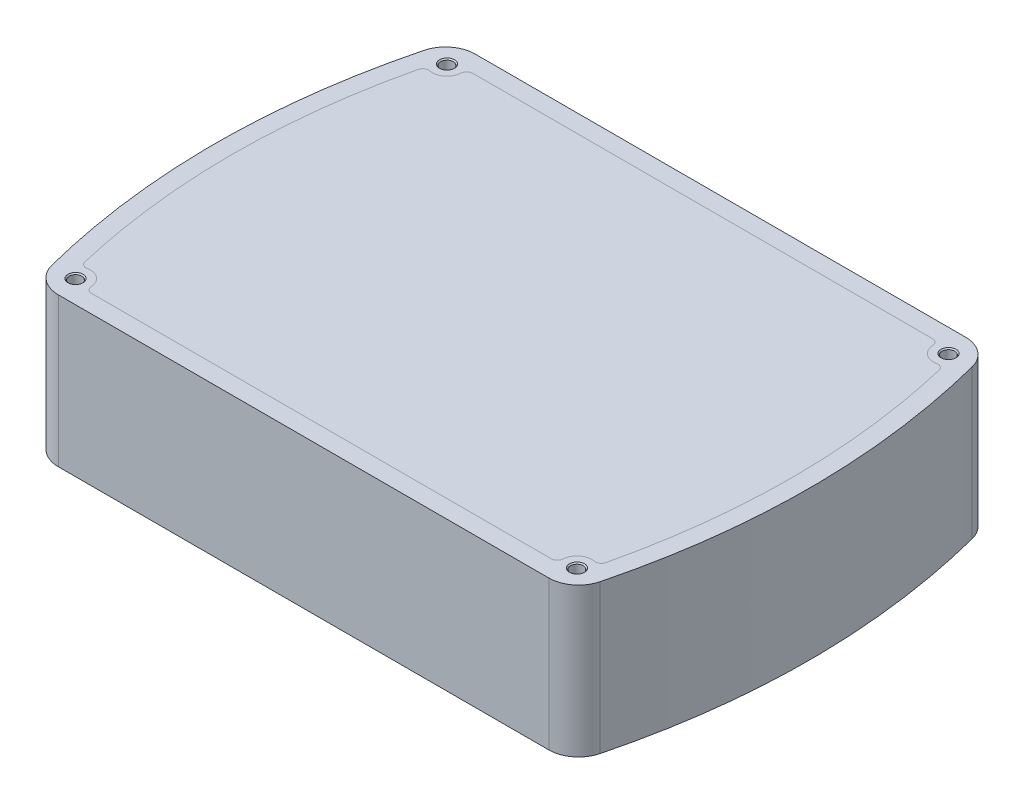
from build123d import *

# Parameters (mm, degrees)
BOSS_EXTRUDE1_DEPTH                    = 50
FILLET5_R                              = 10
SHELL1_T                               = -6
SKETCH18_R                             = 5
BOSS_EXTRUDE2_DEPTH                    = 44
CBORE_FOR_M5_HEX_HEAD_BOLT1_AT_2_COUNT = 2
CBORE_FOR_M5_HEX_HEAD_BOLT1_AT_2_PITCH = 168.372502246
CBORE_FOR_M5_HEX_HEAD_BOLT1_AT_3_COUNT = 2
CBORE_FOR_M5_HEX_HEAD_BOLT1_AT_3_PITCH = 209.544351234
CBORE_FOR_M5_HEX_HEAD_BOLT1_AT_4_COUNT = 2
CBORE_FOR_M5_HEX_HEAD_BOLT1_AT_4_PITCH = 124.737867634
FILLET6_R                              = 2
SKETCH21_R                             = 3
BOSS_EXTRUDE3_DEPTH                    = 10
LPATTERN1_COUNT                        = 2
LPATTERN1_PITCH                        = 30.48
LPATTERN1_COUNT_DIR2                   = 2
LPATTERN1_PITCH_DIR2                   = 55.88
SKETCH21_3_R                           = 3
BOSS_EXTRUDE4_DEPTH                    = 10
LPATTERN3_COUNT                        = 2
LPATTERN3_PITCH                        = 16.51
LPATTERN3_COUNT_DIR2                   = 2
LPATTERN3_PITCH_DIR2                   = 17.78
LPATTERN3_2_COUNT                      = 2
LPATTERN3_2_PITCH                      = 16.51
LPATTERN3_2_COUNT_DIR2                 = 2
LPATTERN3_2_PITCH_DIR2                 = 17.78
INTERSECT1_START                       = 6
INTERSECT1_OUTLINE_R                   = 3
INTERSECT1_DEPTH                       = 44
INTERSECT1_START_2                     = 16
INTERSECT1_2_OUTLINE_R                 = 3
INTERSECT1_2_DEPTH                     = 34
INTERSECT1_START_3                     = 8.4999999
INTERSECT1_3_OUTLINE_R                 = 1.25
INTERSECT1_3_DEPTH                     = 7.5000001
SKETCH26_R                             = 5
CUT_EXTRUDE5_DEPTH                     = 130.753612831
CUT_EXTRUDE7_DEPTH                     = 130.753612831
CUT_EXTRUDE8_DEPTH                     = 130.753612831


with BuildPart() as part:
    # Sketch1 → Boss-Extrude1 (new body)
    with BuildSketch(Plane(origin=(0, 0, 0), x_dir=(1, 0, 0), z_dir=(0, 1, 0))):
        with BuildLine():
            Line((-90, 70), (90, 70))
            add(Edge.make_bspline(
                [(90, 70), (110, 0), (90, -70)],
                knots=[0, 0, 0, 1, 1, 1], degree=2))
            Line((90, -70), (-90, -70))
            add(Edge.make_bspline(
                [(-90, 70), (-110, 0), (-90, -70)],
                knots=[0, 0, 0, 1, 1, 1], degree=2))
        make_face()
    extrude(amount=BOSS_EXTRUDE1_DEPTH)

    # Fillet5
    fillet5_edges = [part.edges().sort_by_distance(p)[0] for p in [
        (-90, 25, 70),
        (90, 25, 70),
        (90, 25, -70),
        (-90, 25, -70),
    ]]
    fillet(fillet5_edges, radius=FILLET5_R)

    # Shell1
    shell1_openings = [part.faces().sort_by_distance(p)[0] for p in [
        (1e-09, 50, 1e-09),
    ]]
    offset(amount=SHELL1_T, openings=shell1_openings)

    # Sketch18 → Boss-Extrude2 (add)
    with BuildSketch(Plane(origin=(0, 50, 0), x_dir=(1, 0, 0), z_dir=(0, 1, 0))):
        with Locations((-84.186251123, 62.368933817)):
            Circle(SKETCH18_R)
        with Locations((84.186251123, 62.368933817)):
            Circle(SKETCH18_R)
        with Locations((84.186251123, -62.368933817)):
            Circle(SKETCH18_R)
        with Locations((-84.186251123, -62.368933817)):
            Circle(SKETCH18_R)
    extrude(amount=-BOSS_EXTRUDE2_DEPTH)

    # Sketch20 → CBORE for M5 Hex Head Bolt1 (revolve, cut)
    with BuildSketch(Plane(origin=(-84.186251123, 50, -62.368933817), x_dir=(0, 0, 1), z_dir=(1, 0, 0))):
        Polygon((0, 0), (0, 10.901290929), (1.5, 10), (1.5, 4.375), (2.125, 4.375), (2.125, 0.375), (2.5, 0), align=None)
    cbore_for_m5_hex_head_bolt1 = revolve(axis=Axis((-84.186251123, 56.35, -62.368933817), (0, -1, 0)), mode=Mode.SUBTRACT)

    # CBORE for M5 Hex Head Bolt1 at 2: CBORE for M5 Hex Head Bolt1 ×2
    with Locations(*[(i * CBORE_FOR_M5_HEX_HEAD_BOLT1_AT_2_PITCH, 0, 0) for i in range(1, CBORE_FOR_M5_HEX_HEAD_BOLT1_AT_2_COUNT)]):
        add(cbore_for_m5_hex_head_bolt1, mode=Mode.SUBTRACT)

    # CBORE for M5 Hex Head Bolt1 at 3: CBORE for M5 Hex Head Bolt1 ×2
    with Locations(*[Vector(0.8035172566273735, 0, 0.595281461413019) * (i * CBORE_FOR_M5_HEX_HEAD_BOLT1_AT_3_PITCH) for i in range(1, CBORE_FOR_M5_HEX_HEAD_BOLT1_AT_3_COUNT)]):
        add(cbore_for_m5_hex_head_bolt1, mode=Mode.SUBTRACT)

    # CBORE for M5 Hex Head Bolt1 at 4: CBORE for M5 Hex Head Bolt1 ×2
    with Locations(*[(0, 0, i * CBORE_FOR_M5_HEX_HEAD_BOLT1_AT_4_PITCH) for i in range(1, CBORE_FOR_M5_HEX_HEAD_BOLT1_AT_4_COUNT)]):
        add(cbore_for_m5_hex_head_bolt1, mode=Mode.SUBTRACT)

    # Fillet6
    fillet6_edges = [part.edges().sort_by_distance(p)[0] for p in [
        (-79.459770074, 28, 64),
        (-86.920475715, 28, 58.182764222),
        (79.459770074, 28, 64),
        (86.920475715, 28, 58.182764222),
        (86.920475715, 28, -58.182764222),
        (79.459770074, 28, -64),
        (-86.920475715, 28, -58.182764222),
        (-79.459770074, 28, -64),
    ]]
    fillet(fillet6_edges, radius=FILLET6_R)

    # Sketch21 → Boss-Extrude3 (add)
    with BuildSketch(Plane(origin=(0, 6, 0), x_dir=(1, 0, 0), z_dir=(0, 1, 0))):
        with Locations(Location((-40, -27.94, 0), (0, 0, 270))):
            Circle(SKETCH21_R)
    boss_extrude3 = extrude(amount=BOSS_EXTRUDE3_DEPTH)

    # Sketch23 → M3x0.5 Tapped Hole2 (revolve, cut)
    with BuildSketch(Plane(origin=(-40, 16, 27.94), x_dir=(0, 0, 1), z_dir=(1, 0, 0))):
        Polygon((0, 0), (0, 8.251075774), (1.25, 7.5), (1.25, 0), align=None)
    m3x0_5_tapped_hole2 = revolve(axis=Axis((-40, 22.35, 27.94), (0, -1, 0)), mode=Mode.SUBTRACT)

    # LPattern1: Boss-Extrude3, M3x0.5 Tapped Hole2 2 × 2
    with Locations(*[(-i * LPATTERN1_PITCH, 0, -j * LPATTERN1_PITCH_DIR2) for i in range(LPATTERN1_COUNT) for j in range(LPATTERN1_COUNT_DIR2) if (i, j) != (0, 0)]):
        add(boss_extrude3)
        add(m3x0_5_tapped_hole2, mode=Mode.SUBTRACT)

    # Sketch26 → Cut-Extrude5 (cut, through all)
    with BuildSketch(Plane(origin=(0, 6, 0), x_dir=(1, 0, 0), z_dir=(0, 1, 0))):
        with Locations(Location((0, -50, 0), (0, 0, 270))):
            Circle(SKETCH26_R)
    extrude(amount=-CUT_EXTRUDE5_DEPTH, mode=Mode.SUBTRACT)

    # Sketch26<4> → Cut-Extrude7 (cut, through all)
    with BuildSketch(Plane(origin=(0, 6, 0), x_dir=(1, 0, 0), z_dir=(0, 1, 0))):
        with BuildLine():
            Line((-87, 1.7526), (-81, 1.7526))
            ThreePointArc((-81, 1.7526), (-79.2474, 0), (-81, -1.7526))
            Line((-81, -1.7526), (-87, -1.7526))
            ThreePointArc((-87, -1.7526), (-88.7526, 0), (-87, 1.7526))
        make_face()
    extrude(amount=-CUT_EXTRUDE7_DEPTH, mode=Mode.SUBTRACT)

    # Sketch26<5> → Cut-Extrude8 (cut, through all)
    with BuildSketch(Plane(origin=(0, 6, 0), x_dir=(1, 0, 0), z_dir=(0, 1, 0))):
        with BuildLine():
            Line((85.7526, 3), (85.7526, -3))
            ThreePointArc((85.7526, -3), (84, -4.7526), (82.2474, -3))
            Line((82.2474, -3), (82.2474, 3))
            ThreePointArc((82.2474, 3), (84, 4.7526), (85.7526, 3))
        make_face()
    extrude(amount=-CUT_EXTRUDE8_DEPTH, mode=Mode.SUBTRACT)


with BuildPart() as body_2:
    # Sketch21<3> → Boss-Extrude4 (new body)
    with BuildSketch(Plane(origin=(0, 6, 0), x_dir=(1, 0, 0), z_dir=(0, 1, 0))):
        with Locations(Location((-40, -40, 0), (0, 0, 270))):
            Circle(SKETCH21_3_R)
    boss_extrude4 = extrude(amount=BOSS_EXTRUDE4_DEPTH)

    # Sketch25 → M3x0.5 Tapped Hole3 (revolve, cut)
    with BuildSketch(Plane(origin=(-40, 16, 40), x_dir=(0, 0, 1), z_dir=(1, 0, 0))):
        Polygon((0, 0), (0, 8.251075774), (1.25, 7.5), (1.25, 0), align=None)
    m3x0_5_tapped_hole3 = revolve(axis=Axis((-40, 22.35, 40), (0, -1, 0)), mode=Mode.SUBTRACT)


with BuildPart() as lpattern3_1:
    # LPattern3: pattern copy
    add(boss_extrude4.moved(Location(Vector(0, 0, 1) * (0 * LPATTERN3_PITCH) + Vector(1, 0, 0) * (1 * LPATTERN3_PITCH_DIR2))))


with BuildPart() as lpattern3_2:
    # LPattern3: pattern copy
    add(boss_extrude4.moved(Location(Vector(0, 0, 1) * (1 * LPATTERN3_PITCH) + Vector(1, 0, 0) * (0 * LPATTERN3_PITCH_DIR2))))


with BuildPart() as lpattern3_3:
    # LPattern3: pattern copy
    add(boss_extrude4.moved(Location(Vector(0, 0, 1) * (1 * LPATTERN3_PITCH) + Vector(1, 0, 0) * (1 * LPATTERN3_PITCH_DIR2))))


with BuildPart() as lpattern3_2_tool:
    # LPattern3 2: M3x0.5 Tapped Hole3 2 × 2
    with Locations(*[(j * LPATTERN3_2_PITCH_DIR2, 0, i * LPATTERN3_2_PITCH) for i in range(LPATTERN3_2_COUNT) for j in range(LPATTERN3_2_COUNT_DIR2) if (i, j) != (0, 0)]):
        add(m3x0_5_tapped_hole3)


with BuildPart() as lpattern3_1_1:
    add(lpattern3_1.part)

    # LPattern3 2: cut by lpattern3_2_tool
    add(lpattern3_2_tool.part, mode=Mode.SUBTRACT)


with BuildPart() as lpattern3_2_1:
    add(lpattern3_2.part)

    # LPattern3 2: cut by lpattern3_2_tool
    add(lpattern3_2_tool.part, mode=Mode.SUBTRACT)


with BuildPart() as lpattern3_3_1:
    add(lpattern3_3.part)

    # LPattern3 2: cut by lpattern3_2_tool
    add(lpattern3_2_tool.part, mode=Mode.SUBTRACT)


with BuildPart() as body_6:
    # Intersect1: read off the stored shape, not the designer's step
    # Intersect1 outline → Intersect1 (new body)
    with BuildSketch(Plane(origin=(0, 0, 0), x_dir=(1, 0, 0), z_dir=(0, 1, 0)).offset(INTERSECT1_START)):
        with BuildLine():
            ThreePointArc((-85.128791279, -57.458575576), (-81.104056188, -58.431920433), (-79.19320045, -62.105409662))
            ThreePointArc((-79.19320045, -62.105409662), (-78.572421367, -63.451002985), (-77.195980181, -64))
            Line((-77.195980181, -64), (77.195980181, -64))
            ThreePointArc((77.195980181, -64), (78.572421367, -63.451002985), (79.19320045, -62.105409662))
            ThreePointArc((79.19320045, -62.105409662), (81.104056188, -58.431920433), (85.128791279, -57.458575576))
            ThreePointArc((85.128791279, -57.458575576), (86.594601718, -57.172087431), (87.453225367, -55.950023141))
            add(Edge.make_bspline(
                [(87.453225367, -55.950023141), (90.72969591, -41.944786742), (93.066661188, -27.953958376), (94.467200113, -13.973982696), (94.9336997, 0), (94.467200113, 13.973982696), (93.066661188, 27.953958376), (90.72969591, 41.944786742), (87.45322535, 55.950023311)],
                knots=[0.090594316, 0.090594316, 0.090594316, 0.090594316, 0.090594316, 0.090594316, 0.090594316, 0.090594316, 0.090594316, 0.909405684, 0.909405684, 0.909405684, 0.909405684, 0.909405684, 0.909405684, 0.909405684, 0.909405684, 0.909405684], degree=8))
            ThreePointArc((87.45322535, 55.950023311), (86.594601718, 57.172087431), (85.128791279, 57.458575576))
            ThreePointArc((85.128791279, 57.458575576), (81.104056188, 58.431920433), (79.19320045, 62.105409662))
            ThreePointArc((79.19320045, 62.105409662), (78.572421367, 63.451002985), (77.195980181, 64))
            Line((77.195980181, 64), (-77.195980181, 64))
            ThreePointArc((-77.195980181, 64), (-78.572421367, 63.451002985), (-79.19320045, 62.105409662))
            ThreePointArc((-79.19320045, 62.105409662), (-81.104056188, 58.431920433), (-85.128791279, 57.458575576))
            ThreePointArc((-85.128791279, 57.458575576), (-86.594601718, 57.172087431), (-87.453225367, 55.950023141))
            add(Edge.make_bspline(
                [(-87.453225367, 55.950023141), (-90.72969591, 41.944786742), (-93.066661188, 27.953958376), (-94.467200113, 13.973982696), (-94.9336997, 0), (-94.467200113, -13.973982696), (-93.066661188, -27.953958376), (-90.72969591, -41.944786742), (-87.45322535, -55.950023311)],
                knots=[0.090594316, 0.090594316, 0.090594316, 0.090594316, 0.090594316, 0.090594316, 0.090594316, 0.090594316, 0.090594316, 0.909405684, 0.909405684, 0.909405684, 0.909405684, 0.909405684, 0.909405684, 0.909405684, 0.909405684, 0.909405684], degree=8))
            ThreePointArc((-87.45322535, -55.950023311), (-86.594601718, -57.172087431), (-85.128791279, -57.458575576))
        make_face()
        with Locations((-40, -40)):
            Circle(INTERSECT1_OUTLINE_R, mode=Mode.SUBTRACT)
        with Locations((-70.48, -27.94)):
            Circle(INTERSECT1_OUTLINE_R, mode=Mode.SUBTRACT)
        with Locations((-40, -27.94)):
            Circle(INTERSECT1_OUTLINE_R, mode=Mode.SUBTRACT)
        with Locations((-70.48, 27.94)):
            Circle(INTERSECT1_OUTLINE_R, mode=Mode.SUBTRACT)
        with Locations((-40, 27.94)):
            Circle(INTERSECT1_OUTLINE_R, mode=Mode.SUBTRACT)
    extrude(amount=INTERSECT1_DEPTH)

    # Intersect1 2 outline → Intersect1 2 (add)
    with BuildSketch(Plane(origin=(0, 0, 0), x_dir=(1, 0, 0), z_dir=(0, 1, 0)).offset(INTERSECT1_START_2)):
        with Locations((-70.48, -27.94)):
            Circle(INTERSECT1_2_OUTLINE_R)
        with Locations((-40, -27.94)):
            Circle(INTERSECT1_2_OUTLINE_R)
        with Locations((-40, 27.94)):
            Circle(INTERSECT1_2_OUTLINE_R)
        with Locations((-70.48, 27.94)):
            Circle(INTERSECT1_2_OUTLINE_R)
        with Locations((-40, -40)):
            Circle(INTERSECT1_2_OUTLINE_R)
    extrude(amount=INTERSECT1_2_DEPTH)

    # Intersect1 3 outline → Intersect1 3 (add)
    with BuildSketch(Plane(origin=(0, 0, 0), x_dir=(1, 0, 0), z_dir=(0, 1, 0)).offset(INTERSECT1_START_3)):
        with Locations((-70.48, -27.94)):
            Circle(INTERSECT1_3_OUTLINE_R)
        with Locations((-40, -27.94)):
            Circle(INTERSECT1_3_OUTLINE_R)
        with Locations((-40, 27.94)):
            Circle(INTERSECT1_3_OUTLINE_R)
        with Locations((-70.48, 27.94)):
            Circle(INTERSECT1_3_OUTLINE_R)
        with Locations((-40, -40)):
            Circle(INTERSECT1_3_OUTLINE_R)
    extrude(amount=INTERSECT1_3_DEPTH)

    # Intersect1 4 outline → Intersect1 4 (revolve)
    with BuildSketch(Plane(origin=(-70.48, 0, 27.94), x_dir=(1, 0, 0), z_dir=(0, 0, 1))):
        Polygon((0, 8.5), (0, 7.748924226), (1.25, 8.5), align=None)
    revolve(axis=Axis((-70.48, 0, 27.94), (0, 1, 0)))

    # Intersect1 5 outline → Intersect1 5 (revolve)
    with BuildSketch(Plane(origin=(-40, 0, 27.94), x_dir=(1, 0, 0), z_dir=(0, 0, 1))):
        Polygon((0, 8.5), (0, 7.748924226), (1.25, 8.5), align=None)
    revolve(axis=Axis((-40, 0, 27.94), (0, 1, 0)))

    # Intersect1 6 outline → Intersect1 6 (revolve)
    with BuildSketch(Plane(origin=(-40, 0, -27.94), x_dir=(1, 0, 0), z_dir=(0, 0, 1))):
        Polygon((0, 8.5), (0, 7.748924226), (1.25, 8.5), align=None)
    revolve(axis=Axis((-40, 0, -27.94), (0, 1, 0)))

    # Intersect1 7 outline → Intersect1 7 (revolve)
    with BuildSketch(Plane(origin=(-70.48, 0, -27.94), x_dir=(1, 0, 0), z_dir=(0, 0, 1))):
        Polygon((0, 8.5), (0, 7.748924226), (1.25, 8.5), align=None)
    revolve(axis=Axis((-70.48, 0, -27.94), (0, 1, 0)))

    # Intersect1 8 outline → Intersect1 8 (revolve)
    with BuildSketch(Plane(origin=(-40, 0, 40), x_dir=(1, 0, 0), z_dir=(0, 0, 1))):
        Polygon((0, 8.5), (0, 7.748924226), (1.25, 8.5), align=None)
    revolve(axis=Axis((-40, 0, 40), (0, 1, 0)))


solid = Compound([part.part, body_2.part, lpattern3_1_1.part, lpattern3_2_1.part, lpattern3_3_1.part, body_6.part])
